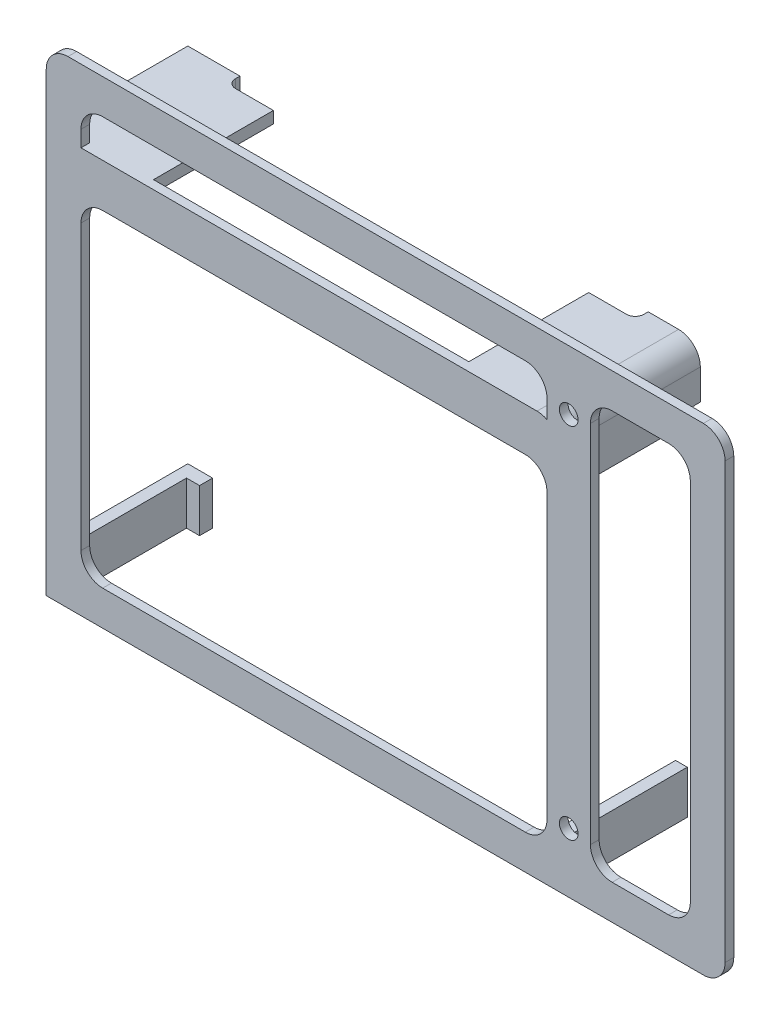
from build123d import *

# Parameters (mm, degrees)
SKETCH1_W             = 156.3
SKETCH1_H             = 110
SKETCH1_W_2           = 107.3
SKETCH1_H_2           = 75.3
SKETCH1_H_3           = 8.7
SKETCH1_W_3           = 23
SKETCH1_H_4           = 94
BOSS_EXTRUDE1_DEPTH   = 2
F_6_CLEARANCE_HOLE1_D = 4.3053
SKETCH6_W             = 2.7
SKETCH6_H             = 10
BOSS_EXTRUDE2_DEPTH   = 27.6
SKETCH7_W             = 5.7
SKETCH7_H             = 10
BOSS_EXTRUDE3_DEPTH   = 3
FILLET3_R             = 5
FILLET4_R             = 2
FILLET5_R             = 5


with BuildPart() as part:
    # Sketch1 → Boss-Extrude1 (new body)
    with BuildSketch(Plane.XY):
        with Locations((78.15, 55)):
            Rectangle(SKETCH1_W, SKETCH1_H)
        with Locations((61.65, 45.65)):
            Rectangle(SKETCH1_W_2, SKETCH1_H_2, mode=Mode.SUBTRACT)
        with Locations((61.65, 97.65)):
            Rectangle(SKETCH1_W_2, SKETCH1_H_3, mode=Mode.SUBTRACT)
        with Locations((136.8, 55)):
            Rectangle(SKETCH1_W_3, SKETCH1_H_4, mode=Mode.SUBTRACT)
    extrude(amount=BOSS_EXTRUDE1_DEPTH)

    # #6 Clearance Hole1 (through all)
    with Locations(Plane(origin=(0, 0, 0), x_dir=(-1, 0, 0), z_dir=(0, 0, -1))):
        with Locations((-120.3, 13.725), (-120.3, 96.275)):
            Hole(F_6_CLEARANCE_HOLE1_D / 2)

    # Sketch6 → Boss-Extrude2 (add)
    with BuildSketch(Plane(origin=(0, 0, 0), x_dir=(-1, 0, 0), z_dir=(0, 0, -1))):
        with Locations((-1.35, 5)):
            Rectangle(SKETCH6_W, SKETCH6_H)
        with Locations((-116.65, 5)):
            Rectangle(SKETCH6_W, SKETCH6_H)
        Polygon((0, 81.3), (0, 93.3), (-22.7, 93.3), (-22.7, 90.6), (-2.7, 90.6), (-2.7, 81.3), align=None)
        Polygon((-95.3, 93.3), (-118, 93.3), (-118, 78.6), (-115.3, 78.6), (-115.3, 90.6), (-95.3, 90.6), align=None)
    extrude(amount=BOSS_EXTRUDE2_DEPTH)

    # Sketch7 → Boss-Extrude3 (add)
    with BuildSketch(Plane(origin=(0, 0, -27.6), x_dir=(-1, 0, 0), z_dir=(0, 0, -1))):
        Polygon((0, 93.3), (0, 81.3), (-5.7, 81.3), (-5.7, 87.6), (-12, 87.6), (-12, 93.3), align=None)
        with Locations((-2.85, 5)):
            Rectangle(SKETCH7_W, SKETCH7_H)
        Polygon((-118, 93.3), (-118, 81.3), (-112.3, 81.3), (-112.3, 87.6), (-106, 87.6), (-106, 93.3), align=None)
    extrude(amount=BOSS_EXTRUDE3_DEPTH)

    # Fillet3
    fillet3_edges = [part.edges().sort_by_distance(p)[0] for p in [
        (118, 93.3, -15.3),
    ]]
    fillet(fillet3_edges, radius=FILLET3_R)

    # Fillet4
    fillet4_edges = [part.edges().sort_by_distance(p)[0] for p in [
        (12, 91.95, -27.6),
        (106, 91.95, -27.6),
        (116.65, 81.3, -27.6),
    ]]
    fillet(fillet4_edges, radius=FILLET4_R)

    # Fillet5
    # the kernel refuses this fillet: 5 mm, written as the material it adds along each edge
    with BuildSketch(Plane(origin=(8, 83.3, 0), x_dir=(1, 0, 0), z_dir=(0, 0, 1)), Plane(origin=(115.3, 83.3, 0), x_dir=(0, -1, 0), z_dir=(0, 0, 1)), Plane(origin=(148.3, 102, 0), x_dir=(0, -1, 0), z_dir=(0, 0, 1)), Plane(origin=(148.3, 8, 0), x_dir=(-1, 0, 0), z_dir=(0, 0, 1)), Plane(origin=(8, 102, 0), x_dir=(1, 0, 0), z_dir=(0, 0, 1)), Plane(origin=(115.3, 102, 0), x_dir=(0, -1, 0), z_dir=(0, 0, 1))) as fillet5_piece_1:
        with BuildLine():
            CenterArc((FILLET5_R, -FILLET5_R), FILLET5_R, 90, 90)
            Line((0, -FILLET5_R), (0, 0))
            Line((0, 0), (FILLET5_R, 0))
        make_face()
    extrude(amount=2)
    with BuildSketch(Plane(origin=(8, 8, 0), x_dir=(1, 0, 0), z_dir=(0, 0, 1)), Plane(origin=(115.3, 8, 0), x_dir=(0, 1, 0), z_dir=(0, 0, 1)), Plane(origin=(125.3, 102, 0), x_dir=(0, -1, 0), z_dir=(0, 0, 1)), Plane(origin=(125.3, 8, 0), x_dir=(1, 0, 0), z_dir=(0, 0, 1))) as fillet5_piece_2:
        with BuildLine():
            CenterArc((FILLET5_R, FILLET5_R), FILLET5_R, 180, 90)
            Line((0, FILLET5_R), (0, 0))
            Line((0, 0), (FILLET5_R, 0))
        make_face()
    extrude(amount=2)
    # the kernel refuses this fillet: 5 mm, written as the material it takes off along each edge
    with BuildSketch(Plane(origin=(0, 110, -12.5), x_dir=(1, 0, 0), z_dir=(0, 0, 1))) as fillet5_2_piece_1:
        with BuildLine():
            CenterArc((FILLET5_R, -FILLET5_R), FILLET5_R, 90, 90)
            Line((0, -FILLET5_R), (0, 0))
            Line((0, 0), (FILLET5_R, 0))
        make_face()
    extrude(amount=27, mode=Mode.SUBTRACT)
    with BuildSketch(Plane(origin=(156.3, 110, -12.5), x_dir=(-1, 0, 0), z_dir=(0, 0, 1)), Plane(origin=(156.3, 0, -12.5), x_dir=(0, 1, 0), z_dir=(0, 0, 1))) as fillet5_2_piece_2:
        with BuildLine():
            CenterArc((FILLET5_R, FILLET5_R), FILLET5_R, 180, 90)
            Line((0, FILLET5_R), (0, 0))
            Line((0, 0), (FILLET5_R, 0))
        make_face()
    extrude(amount=27, mode=Mode.SUBTRACT)


solid = part.part
